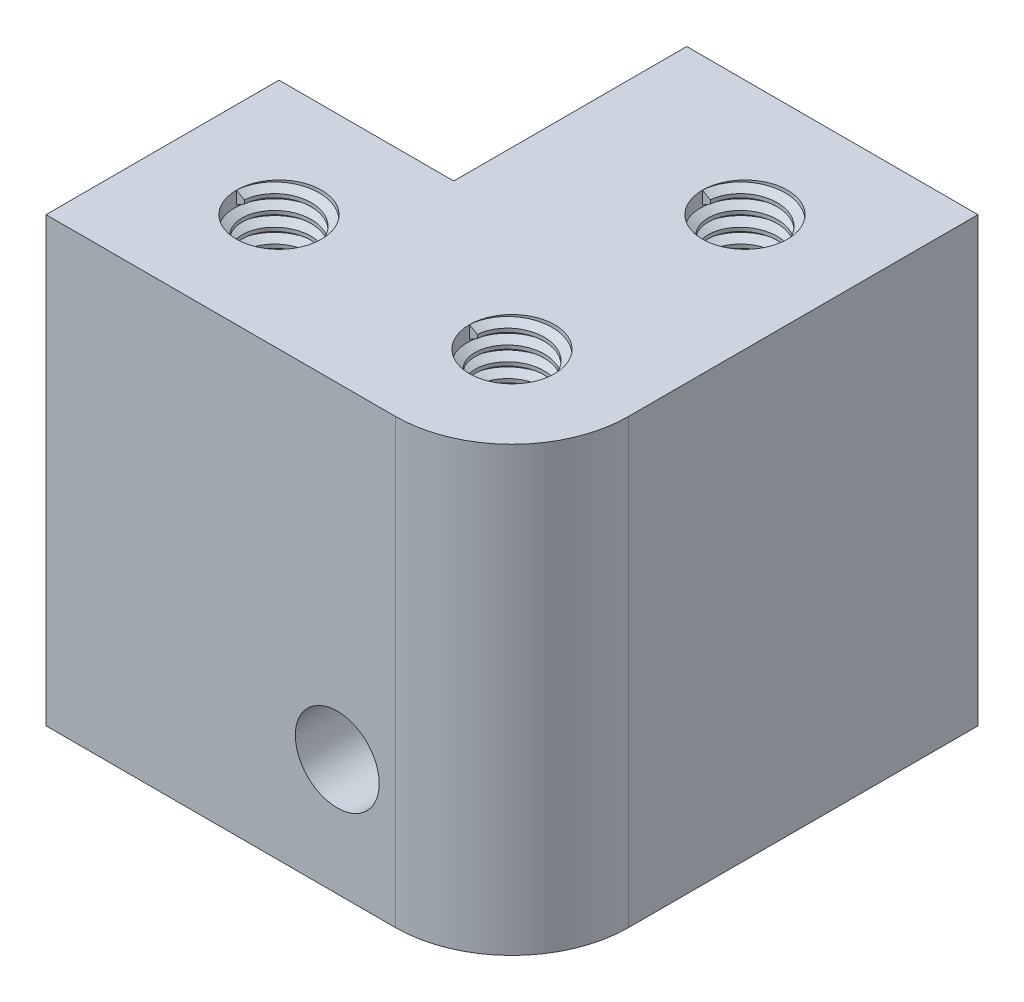
from build123d import *
from build123d.topology import SkipClean

# Parameters (mm, degrees)
BASE_EXTRUDE_DEPTH  = 24.13
SKETCH3_R           = 2.286
AXEL_CUT_DEPTH      = 44.273281595
SKETCH4_R           = 2.31775
CUT_EXTRUDE2_DEPTH  = 12.7
SIDE_THREAD_PITCH   = 0.79375
MIDDLE_THREAD_PITCH = 0.79375
FRONT_THREAD_PITCH  = 0.79375


with BuildPart() as part:
    # Sketch1 → Base Extrude (new body)
    with BuildSketch(Plane(origin=(0, 0, 0), x_dir=(1, 0, 0), z_dir=(0, 1, 0))):
        with BuildLine():
            Line((0, 12.7), (9.525, 12.7))
            Line((9.525, 12.7), (9.525, 25.4))
            Line((9.525, 25.4), (25.4, 25.4))
            Line((25.4, 25.4), (25.4, 6.35))
            ThreePointArc((25.4, 6.35), (23.540128061, 1.859871939), (19.05, 0))
            Line((19.05, 0), (0, 0))
            Line((0, 0), (0, 12.7))
        make_face()
    extrude(amount=BASE_EXTRUDE_DEPTH)

    # Sketch3 → Axel Cut (cut, through all)
    with BuildSketch(Plane.XY):
        with Locations((15.875, 6.35)):
            Circle(SKETCH3_R)
    extrude(amount=-AXEL_CUT_DEPTH, mode=Mode.SUBTRACT)

    # Sketch4 → Cut-Extrude2 (cut)
    with BuildSketch(Plane(origin=(0, 24.13, 0), x_dir=(1, 0, 0), z_dir=(0, 1, 0))):
        with Locations(Location((6.35, 6.35, 0), (0, 0, 270))):
            Circle(SKETCH4_R)
        with Locations(Location((19.05, 6.35, 0), (0, 0, 270))):
            Circle(SKETCH4_R)
        with Locations(Location((19.05, 19.05, 0), (0, 0, 270))):
            Circle(SKETCH4_R)
    extrude(amount=-CUT_EXTRUDE2_DEPTH, mode=Mode.SUBTRACT)

    # Side Thread: the profile of Thread Profile1 profile screwed along a right-hand helix of 16 turns, 8 arcs to a turn; built about Z, then put on its axis
    side_thread_z = Axis((0, 0, 0), (0, 0, 1))
    side_thread_corners = [(2.31805, 0, -0.000173205), (2.31805, 0, 0.694704453), (1.888120212, 0, 0.446484374), (1.888120212, 0, 0.248046874)]
    with BuildLine(mode=Mode.PRIVATE) as side_thread_profile:
        Line(side_thread_corners[0], side_thread_corners[1])
        Line(side_thread_corners[1], side_thread_corners[2])
        Line(side_thread_corners[2], side_thread_corners[3])
        Line(side_thread_corners[3], side_thread_corners[0])
    side_thread_cap = Face(side_thread_profile.wire())
    side_thread_turn_angles = [0, 22.5, 45, 67.5, 90, 112.5, 135, 157.5, 180, 202.5, 225, 247.5, 270, 292.5, 315, 337.5, 360]
    side_thread_turn_weights = [1, 0.9238795325112867, 1, 0.9238795325112867, 1, 0.9238795325112867, 1, 0.9238795325112867, 1, 0.9238795325112867, 1, 0.9238795325112867, 1, 0.9238795325112867, 1, 0.9238795325112867, 1]
    side_thread_turn_rails = [Edge.make_bspline([Vector(p[0], p[1], 0).rotate(side_thread_z, side_thread_turn_angles[k]) / side_thread_turn_weights[k] + Vector(0, 0, p[2] + SIDE_THREAD_PITCH * side_thread_turn_angles[k] / 360) for k in range(17)], [0, 0, 0, 1, 1, 2, 2, 3, 3, 4, 4, 5, 5, 6, 6, 7, 7, 8, 8, 8], 2, side_thread_turn_weights) for p in side_thread_corners]
    side_thread_turn_sides = [Face.make_surface_from_curves(side_thread_turn_rails[p[0]], side_thread_turn_rails[p[1]]) for p in [(0, 1), (1, 2), (2, 3), (3, 0)]]
    side_thread = Plane(origin=(6.35, 24.13, -6.35), x_dir=(-1, 0, 0), z_dir=(0, -1, 0)) * Solid(Shell([*[p.moved(Location((0, 0, SIDE_THREAD_PITCH * i))) for i in range(16) for p in side_thread_turn_sides], side_thread_cap, side_thread_cap.rotate(side_thread_z, 5760).moved(Location((0, 0, SIDE_THREAD_PITCH * 5760 / 360)))]))
    add(side_thread)

    # Middle Thread: the profile of Thread Profile2 profile screwed along a right-hand helix of 16 turns, 8 arcs to a turn; built about Z, then put on its axis
    with SkipClean():  # the faces are left unmerged after this step: merging them gives an invalid solid
        middle_thread_z = Axis((0, 0, 0), (0, 0, 1))
        middle_thread_corners = [(2.31805, 0, -0.000173205), (2.31805, 0, 0.694704453), (1.888120212, 0, 0.446484374), (1.888120212, 0, 0.248046874)]
        with BuildLine(mode=Mode.PRIVATE) as middle_thread_profile:
            Line(middle_thread_corners[0], middle_thread_corners[1])
            Line(middle_thread_corners[1], middle_thread_corners[2])
            Line(middle_thread_corners[2], middle_thread_corners[3])
            Line(middle_thread_corners[3], middle_thread_corners[0])
        middle_thread_cap = Face(middle_thread_profile.wire())
        middle_thread_turn_angles = [0, 22.5, 45, 67.5, 90, 112.5, 135, 157.5, 180, 202.5, 225, 247.5, 270, 292.5, 315, 337.5, 360]
        middle_thread_turn_weights = [1, 0.9238795325112867, 1, 0.9238795325112867, 1, 0.9238795325112867, 1, 0.9238795325112867, 1, 0.9238795325112867, 1, 0.9238795325112867, 1, 0.9238795325112867, 1, 0.9238795325112867, 1]
        middle_thread_turn_rails = [Edge.make_bspline([Vector(p[0], p[1], 0).rotate(middle_thread_z, middle_thread_turn_angles[k]) / middle_thread_turn_weights[k] + Vector(0, 0, p[2] + MIDDLE_THREAD_PITCH * middle_thread_turn_angles[k] / 360) for k in range(17)], [0, 0, 0, 1, 1, 2, 2, 3, 3, 4, 4, 5, 5, 6, 6, 7, 7, 8, 8, 8], 2, middle_thread_turn_weights) for p in middle_thread_corners]
        middle_thread_turn_sides = [Face.make_surface_from_curves(middle_thread_turn_rails[p[0]], middle_thread_turn_rails[p[1]]) for p in [(0, 1), (1, 2), (2, 3), (3, 0)]]
        middle_thread = Plane(origin=(19.05, 24.13, -6.35), x_dir=(-1, 0, 0), z_dir=(0, -1, 0)) * Solid(Shell([*[p.moved(Location((0, 0, MIDDLE_THREAD_PITCH * i))) for i in range(16) for p in middle_thread_turn_sides], middle_thread_cap, middle_thread_cap.rotate(middle_thread_z, 5760).moved(Location((0, 0, MIDDLE_THREAD_PITCH * 5760 / 360)))]))
        add(middle_thread)

    # Front Thread: the profile of Thread Profile3 profile screwed along a right-hand helix of 16 turns, 8 arcs to a turn; built about Z, then put on its axis
    with SkipClean():  # the faces are left unmerged after this step: merging them gives an invalid solid
        front_thread_z = Axis((0, 0, 0), (0, 0, 1))
        front_thread_corners = [(2.31805, 0, -0.000173205), (2.31805, 0, 0.694704453), (1.888120212, 0, 0.446484374), (1.888120212, 0, 0.248046874)]
        with BuildLine(mode=Mode.PRIVATE) as front_thread_profile:
            Line(front_thread_corners[0], front_thread_corners[1])
            Line(front_thread_corners[1], front_thread_corners[2])
            Line(front_thread_corners[2], front_thread_corners[3])
            Line(front_thread_corners[3], front_thread_corners[0])
        front_thread_cap = Face(front_thread_profile.wire())
        front_thread_turn_angles = [0, 22.5, 45, 67.5, 90, 112.5, 135, 157.5, 180, 202.5, 225, 247.5, 270, 292.5, 315, 337.5, 360]
        front_thread_turn_weights = [1, 0.9238795325112867, 1, 0.9238795325112867, 1, 0.9238795325112867, 1, 0.9238795325112867, 1, 0.9238795325112867, 1, 0.9238795325112867, 1, 0.9238795325112867, 1, 0.9238795325112867, 1]
        front_thread_turn_rails = [Edge.make_bspline([Vector(p[0], p[1], 0).rotate(front_thread_z, front_thread_turn_angles[k]) / front_thread_turn_weights[k] + Vector(0, 0, p[2] + FRONT_THREAD_PITCH * front_thread_turn_angles[k] / 360) for k in range(17)], [0, 0, 0, 1, 1, 2, 2, 3, 3, 4, 4, 5, 5, 6, 6, 7, 7, 8, 8, 8], 2, front_thread_turn_weights) for p in front_thread_corners]
        front_thread_turn_sides = [Face.make_surface_from_curves(front_thread_turn_rails[p[0]], front_thread_turn_rails[p[1]]) for p in [(0, 1), (1, 2), (2, 3), (3, 0)]]
        front_thread = Plane(origin=(19.05, 24.13, -19.05), x_dir=(-1, 0, 0), z_dir=(0, -1, 0)) * Solid(Shell([*[p.moved(Location((0, 0, FRONT_THREAD_PITCH * i))) for i in range(16) for p in front_thread_turn_sides], front_thread_cap, front_thread_cap.rotate(front_thread_z, 5760).moved(Location((0, 0, FRONT_THREAD_PITCH * 5760 / 360)))]))
        add(front_thread)


solid = part.part
